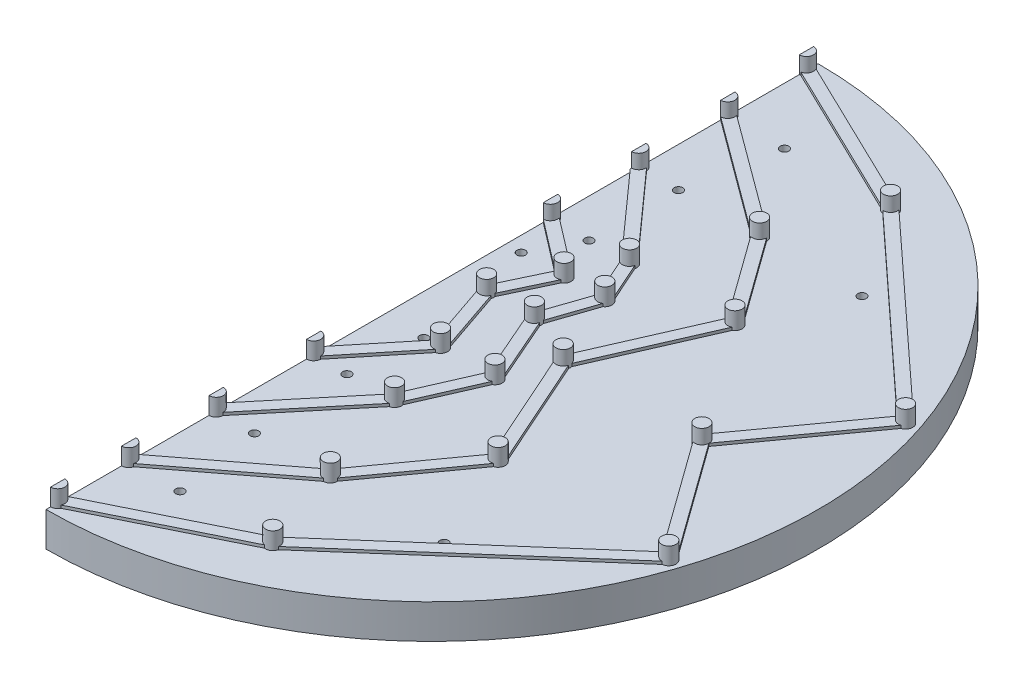
from build123d import *

# Parameters (mm, degrees)
SKETCH1_R           = 135
SKETCH1_R_2         = 7.082134324
BOSS_EXTRUDE3_DEPTH = 9
SKETCH4_R           = 135
BOSS_EXTRUDE4_DEPTH = 8
SKETCH5_R           = 2.5
SKETCH5_R_2         = 0.5
BOSS_EXTRUDE5_DEPTH = 10
BOSS_EXTRUDE7_DEPTH = 5
CUT_EXTRUDE2_START  = -9
SKETCH12_R          = 7.082134324
CUT_EXTRUDE2_DEPTH  = 9
SKETCH8_R           = 135
BOSS_EXTRUDE8_DEPTH = 4
SKETCH9_R           = 1.5
CUT_EXTRUDE1_DEPTH  = 18
CUT_EXTRUDE5_DEPTH  = 5
CUT_EXTRUDE6_DEPTH  = 20


with BuildPart() as part:
    # Sketch1 → Boss-Extrude3 (new body)
    # profile 1 of 84: a face of its own
    with BuildSketch(Plane(origin=(0, 0, 0), x_dir=(1, 0, 0), z_dir=(0, 1, 0))):
        with Locations(Location((0, 0, 0), (0, 0, 270))):
            Circle(SKETCH1_R)
        with BuildLine():
            Line((-124.38352904, -41.253827153), (-124.277916907, -41.10729095))
            ThreePointArc((-124.277916907, -41.10729095), (-130.9, 0), (-124.277916907, 41.10729095))
            Line((-124.277916907, 41.10729095), (-124.38352904, 41.253827153))
            ThreePointArc((-124.38352904, 41.253827153), (-124.403249594, 41.513922755), (-124.180715089, 41.65))
            Line((-124.180715089, 41.65), (-124.097089007, 41.65))
            ThreePointArc((-124.097089007, 41.65), (-76.554277846, 106.180283214), (-0.308426084, 130.899636643))
            Line((-0.308426084, 130.899636643), (-0.202813951, 131.046172847))
            ThreePointArc((-0.202813951, 131.046172847), (0, 131.15), (0.202813951, 131.046172847))
            Line((0.202813951, 131.046172847), (0.308426084, 130.899636643))
            ThreePointArc((0.308426084, 130.899636643), (76.554277846, 106.180283214), (124.097089007, 41.65))
            Line((124.097089007, 41.65), (124.180715089, 41.65))
            ThreePointArc((124.180715089, 41.65), (124.403249594, 41.513922755), (124.38352904, 41.253827153))
            Line((124.38352904, 41.253827153), (124.277916907, 41.10729095))
            ThreePointArc((124.277916907, 41.10729095), (129.233875828, 20.8186296), (130.9, 0))
            ThreePointArc((130.9, 0), (129.233875828, -20.8186296), (124.277916907, -41.10729095))
            Line((124.277916907, -41.10729095), (124.38352904, -41.253827153))
            ThreePointArc((124.38352904, -41.253827153), (124.403249594, -41.513922755), (124.180715089, -41.65))
            Line((124.180715089, -41.65), (124.097089007, -41.65))
            ThreePointArc((124.097089007, -41.65), (76.554277846, -106.180283214), (0.308426084, -130.899636643))
            Line((0.308426084, -130.899636643), (0.202813951, -131.046172847))
            ThreePointArc((0.202813951, -131.046172847), (0, -131.15), (-0.202813951, -131.046172847))
            Line((-0.202813951, -131.046172847), (-0.308426084, -130.899636643))
            ThreePointArc((-0.308426084, -130.899636643), (-76.554277846, -106.180283214), (-124.097089007, -41.65))
            Line((-124.097089007, -41.65), (-124.180715089, -41.65))
            ThreePointArc((-124.180715089, -41.65), (-124.403249594, -41.513922755), (-124.38352904, -41.253827153))
        make_face(mode=Mode.SUBTRACT)
    # profile 2 of 84: a face of its own
    with BuildSketch(Plane(origin=(0, 0, 0), x_dir=(1, 0, 0), z_dir=(0, 1, 0))):
        with BuildLine():
            Line((94.650912929, 0), (124.277916907, -41.10729095))
            ThreePointArc((124.277916907, -41.10729095), (129.233875828, -20.8186296), (130.9, 0))
            ThreePointArc((130.9, 0), (129.233875828, 20.8186296), (124.277916907, 41.10729095))
            Line((124.277916907, 41.10729095), (94.650912929, 0))
        make_face()
    # profile 3 of 84: a face of its own
    with BuildSketch(Plane(origin=(0, 0, 0), x_dir=(1, 0, 0), z_dir=(0, 1, 0))):
        with BuildLine():
            Line((18.039369117, -106.298059158), (0.308426084, -130.899636643))
            ThreePointArc((0.308426084, -130.899636643), (76.554277846, -106.180283214), (124.097089007, -41.65))
            Line((124.097089007, -41.65), (64.889843958, -41.65))
            Line((64.889843958, -41.65), (79.924154275, -75.397063248))
            ThreePointArc((79.924154275, -75.397063248), (79.905473966, -75.634935118), (79.695790923, -75.748799079))
            Line((79.695790923, -75.748799079), (40.278539032, -75.748799079))
            Line((40.278539032, -75.748799079), (50.600214945, -105.967250897))
            ThreePointArc((50.600214945, -105.967250897), (50.566984629, -106.193486003), (50.363635096, -106.298059158))
            Line((50.363635096, -106.298059158), (18.039369117, -106.298059158))
        make_face()
    # profile 4 of 84: a face of its own
    with BuildSketch(Plane(origin=(0, 0, 0), x_dir=(1, 0, 0), z_dir=(0, 1, 0))):
        Polygon((39.848815576, -76.037582544), (18.399731029, -105.798059158), (50.014061514, -105.798059158), align=None)
    # profile 5 of 84: a face of its own
    with BuildSketch(Plane(origin=(0, 0, 0), x_dir=(1, 0, 0), z_dir=(0, 1, 0))):
        Polygon((0.382245002, -105.798059158), (17.78340262, -105.798059158), (39.44062029, -75.748799079), (13.528033374, -75.748799079), align=None)
    # profile 6 of 84: a face of its own
    with BuildSketch(Plane(origin=(0, 0, 0), x_dir=(1, 0, 0), z_dir=(0, 1, 0))):
        Polygon((-4e-09, -75.748799079), (-12.982280674, -75.748799079), (0, -105.42430559), (12.982280674, -75.748799079), align=None)
    # profile 7 of 84: a face of its own
    with BuildSketch(Plane(origin=(0, 0, 0), x_dir=(1, 0, 0), z_dir=(0, 1, 0))):
        Polygon((-2e-09, -106.298059158), (-17.423040707, -106.298059158), (0, -130.472424008), (17.423040707, -106.298059158), align=None)
    # profile 8 of 84: a face of its own
    with BuildSketch(Plane(origin=(0, 0, 0), x_dir=(1, 0, 0), z_dir=(0, 1, 0))):
        Polygon((-39.44062029, -75.748799079), (-17.78340262, -105.798059158), (-0.382245002, -105.798059158), (-13.528033374, -75.748799079), align=None)
    # profile 9 of 84: a face of its own
    with BuildSketch(Plane(origin=(0, 0, 0), x_dir=(1, 0, 0), z_dir=(0, 1, 0))):
        Polygon((-50.014061514, -105.798059158), (-18.399731029, -105.798059158), (-39.848815576, -76.037582544), align=None)
    # profile 10 of 84: a face of its own
    with BuildSketch(Plane(origin=(0, 0, 0), x_dir=(1, 0, 0), z_dir=(0, 1, 0))):
        with BuildLine():
            Line((-64.889843958, -41.65), (-124.097089007, -41.65))
            ThreePointArc((-124.097089007, -41.65), (-76.554277846, -106.180283214), (-0.308426084, -130.899636643))
            Line((-0.308426084, -130.899636643), (-18.039369117, -106.298059158))
            Line((-18.039369117, -106.298059158), (-50.363635096, -106.298059158))
            ThreePointArc((-50.363635096, -106.298059158), (-50.566984629, -106.193486003), (-50.600214945, -105.967250897))
            Line((-50.600214945, -105.967250897), (-40.278539032, -75.748799079))
            Line((-40.278539032, -75.748799079), (-79.695790923, -75.748799079))
            ThreePointArc((-79.695790923, -75.748799079), (-79.905473966, -75.634935118), (-79.924154275, -75.397063248))
            Line((-79.924154275, -75.397063248), (-64.889843958, -41.65))
        make_face()
    # profile 11 of 84: a face of its own
    with BuildSketch(Plane(origin=(0, 0, 0), x_dir=(1, 0, 0), z_dir=(0, 1, 0))):
        with BuildLine():
            ThreePointArc((-124.277916907, 41.10729095), (-130.9, 0), (-124.277916907, -41.10729095))
            Line((-124.277916907, -41.10729095), (-94.650912929, 0))
            Line((-94.650912929, 0), (-124.277916907, 41.10729095))
        make_face()
    # profile 12 of 84: a face of its own
    with BuildSketch(Plane(origin=(0, 0, 0), x_dir=(1, 0, 0), z_dir=(0, 1, 0))):
        with BuildLine():
            ThreePointArc((-0.308426084, 130.899636643), (-76.554277846, 106.180283214), (-124.097089007, 41.65))
            Line((-124.097089007, 41.65), (-64.887027362, 41.65))
            Line((-64.887027362, 41.65), (-78.251547748, 72.199247985))
            ThreePointArc((-78.251547748, 72.199247985), (-78.231730987, 72.436287213), (-78.022506278, 72.549447812))
            Line((-78.022506278, 72.549447812), (-42.629642686, 72.549447812))
            Line((-42.629642686, 72.549447812), (-57.169541703, 103.285033746))
            ThreePointArc((-57.169541703, 103.285033746), (-57.154771859, 103.525681685), (-56.943553046, 103.641940842))
            Line((-56.943553046, 103.641940842), (-19.953696869, 103.641940842))
            Line((-19.953696869, 103.641940842), (-0.308426084, 130.899636643))
        make_face()
    # profile 13 of 84: a face of its own
    with BuildSketch(Plane(origin=(0, 0, 0), x_dir=(1, 0, 0), z_dir=(0, 1, 0))):
        Polygon((-42.189962082, 72.789255758), (-20.314058782, 103.141940842), (-56.548724494, 103.141940842), align=None)
    # profile 14 of 84: a face of its own
    with BuildSketch(Plane(origin=(0, 0, 0), x_dir=(1, 0, 0), z_dir=(0, 1, 0))):
        Polygon((-0.385061599, 103.141940842), (-19.697730373, 103.141940842), (-41.746468973, 72.549447812), (-14.014011478, 72.549447812), align=None)
    # profile 15 of 84: a face of its own
    with BuildSketch(Plane(origin=(0, 0, 0), x_dir=(1, 0, 0), z_dir=(0, 1, 0))):
        Polygon((0, 102.777604677), (-13.466638187, 72.549447812), (0, 72.549447812), (13.466638187, 72.549447812), align=None)
    # profile 16 of 84: a face of its own
    with BuildSketch(Plane(origin=(0, 0, 0), x_dir=(1, 0, 0), z_dir=(0, 1, 0))):
        Polygon((0, 130.472424008), (-19.33736846, 103.641940842), (-4e-09, 103.641940842), (19.33736846, 103.641940842), align=None)
    # profile 17 of 84: a face of its own
    with BuildSketch(Plane(origin=(0, 0, 0), x_dir=(1, 0, 0), z_dir=(0, 1, 0))):
        Polygon((41.746468973, 72.549447812), (19.697730373, 103.141940842), (0.385061599, 103.141940842), (14.014011478, 72.549447812), align=None)
    # profile 18 of 84: a face of its own
    with BuildSketch(Plane(origin=(0, 0, 0), x_dir=(1, 0, 0), z_dir=(0, 1, 0))):
        Polygon((56.548724494, 103.141940842), (20.314058782, 103.141940842), (42.189962082, 72.789255758), align=None)
    # profile 19 of 84: a face of its own
    with BuildSketch(Plane(origin=(0, 0, 0), x_dir=(1, 0, 0), z_dir=(0, 1, 0))):
        Polygon((42.723159295, 72.049447812), (64.451376596, 41.901676169), (77.640261276, 72.049447812), align=None)
    # profile 20 of 84: a face of its own
    with BuildSketch(Plane(origin=(0, 0, 0), x_dir=(1, 0, 0), z_dir=(0, 1, 0))):
        Polygon((64.99312752, 41.15), (94.342748724, 0.427575992), (123.692369928, 41.15), align=None)
    # profile 21 of 84: a face of its own
    with BuildSketch(Plane(origin=(0, 0, 0), x_dir=(1, 0, 0), z_dir=(0, 1, 0))):
        Polygon((94.342748724, -0.427575992), (64.99312752, -41.15), (123.692369928, -41.15), align=None)
    # profile 22 of 84: a face of its own
    with BuildSketch(Plane(origin=(0, 0, 0), x_dir=(1, 0, 0), z_dir=(0, 1, 0))):
        Polygon((46.501999473, -0.37535968), (64.556200791, -40.90108124), (94.034584519, 0), (64.558188122, 40.898323831), align=None)
    # profile 23 of 84: a face of its own
    with BuildSketch(Plane(origin=(0, 0, 0), x_dir=(1, 0, 0), z_dir=(0, 1, 0))):
        Polygon((34.76781542, 25.964009606), (46.226642998, 0.242724701), (64.122537357, 41.15), (28.002459562, 41.15), align=None)
    # profile 24 of 84: a face of its own
    with BuildSketch(Plane(origin=(0, 0, 0), x_dir=(1, 0, 0), z_dir=(0, 1, 0))):
        Polygon((20.661887706, 26.112273784), (34.154390465, 26.112273784), (27.610580002, 40.800967905), align=None)
    # profile 25 of 84: a face of its own
    with BuildSketch(Plane(origin=(0, 0, 0), x_dir=(1, 0, 0), z_dir=(0, 1, 0))):
        Polygon((28.012226515, 41.65), (64.016437198, 41.65), (42.279666185, 71.809639867), align=None)
    # profile 26 of 84: a face of its own
    with BuildSketch(Plane(origin=(0, 0, 0), x_dir=(1, 0, 0), z_dir=(0, 1, 0))):
        Polygon((41.839985581, 72.049447812), (14.236761384, 72.049447812), (27.624215923, 41.999032095), align=None)
    # profile 27 of 84: a face of its own
    with BuildSketch(Plane(origin=(0, 0, 0), x_dir=(1, 0, 0), z_dir=(0, 1, 0))):
        Polygon((20.276224505, 26.46626798), (27.22256941, 41.15), (13.86765052, 41.15), align=None)
    # profile 28 of 84: a face of its own
    with BuildSketch(Plane(origin=(0, 0, 0), x_dir=(1, 0, 0), z_dir=(0, 1, 0))):
        Polygon((27.232336364, 41.65), (13.689388092, 72.049447812), (0.381882927, 72.049447812), (13.649430316, 41.65), align=None)
    # profile 29 of 84: a face of its own
    with BuildSketch(Plane(origin=(0, 0, 0), x_dir=(1, 0, 0), z_dir=(0, 1, 0))):
        Polygon((0, 71.674453378), (-13.103884665, 41.65), (0, 41.65), (13.103884665, 41.65), align=None)
    # profile 30 of 84: a face of its own
    with BuildSketch(Plane(origin=(0, 0, 0), x_dir=(1, 0, 0), z_dir=(0, 1, 0))):
        Polygon((-0.349573581, 41.15), (-13.322104869, 41.15), (-19.885176226, 26.112273784), (-5.485989484, 26.112273784), align=None)
    # profile 31 of 84: a face of its own
    with BuildSketch(Plane(origin=(0, 0, 0), x_dir=(1, 0, 0), z_dir=(0, 1, 0))):
        Polygon((-27.610580002, 40.800967905), (-34.154390465, 26.112273784), (-20.661887706, 26.112273784), align=None)
    # profile 32 of 84: a face of its own
    with BuildSketch(Plane(origin=(0, 0, 0), x_dir=(1, 0, 0), z_dir=(0, 1, 0))):
        Polygon((-13.86765052, 41.15), (-27.22256941, 41.15), (-20.276224505, 26.46626798), align=None)
    # profile 33 of 84: a face of its own
    with BuildSketch(Plane(origin=(0, 0, 0), x_dir=(1, 0, 0), z_dir=(0, 1, 0))):
        Polygon((-13.689388092, 72.049447812), (-27.232336364, 41.65), (-13.649430316, 41.65), (-0.381882927, 72.049447812), align=None)
    # profile 34 of 84: a face of its own
    with BuildSketch(Plane(origin=(0, 0, 0), x_dir=(1, 0, 0), z_dir=(0, 1, 0))):
        Polygon((-14.236761384, 72.049447812), (-41.839985581, 72.049447812), (-27.624215923, 41.999032095), align=None)
    # profile 35 of 84: a face of its own
    with BuildSketch(Plane(origin=(0, 0, 0), x_dir=(1, 0, 0), z_dir=(0, 1, 0))):
        Polygon((-77.640261276, 72.049447812), (-64.451376596, 41.901676169), (-42.723159295, 72.049447812), align=None)
    # profile 36 of 84: a face of its own
    with BuildSketch(Plane(origin=(0, 0, 0), x_dir=(1, 0, 0), z_dir=(0, 1, 0))):
        Polygon((-42.279666185, 71.809639867), (-64.016437198, 41.65), (-28.012226515, 41.65), align=None)
    # profile 37 of 84: a face of its own
    with BuildSketch(Plane(origin=(0, 0, 0), x_dir=(1, 0, 0), z_dir=(0, 1, 0))):
        Polygon((-64.122537357, 41.15), (-46.226642998, 0.242724701), (-34.767815423, 25.9640096), (-28.002459562, 41.15), align=None)
    # profile 38 of 84: a face of its own
    with BuildSketch(Plane(origin=(0, 0, 0), x_dir=(1, 0, 0), z_dir=(0, 1, 0))):
        Polygon((-123.692369928, 41.15), (-94.342748724, 0.427575992), (-64.99312752, 41.15), align=None)
    # profile 39 of 84: a face of its own
    with BuildSketch(Plane(origin=(0, 0, 0), x_dir=(1, 0, 0), z_dir=(0, 1, 0))):
        Polygon((-94.342748724, -0.427575992), (-123.692369928, -41.15), (-64.99312752, -41.15), align=None)
    # profile 40 of 84: a face of its own
    with BuildSketch(Plane(origin=(0, 0, 0), x_dir=(1, 0, 0), z_dir=(0, 1, 0))):
        Polygon((-64.558188122, 40.898323831), (-94.034584519, 0), (-64.556200791, -40.90108124), (-46.501999473, -0.37535968), align=None)
    # profile 41 of 84: a face of its own
    with BuildSketch(Plane(origin=(0, 0, 0), x_dir=(1, 0, 0), z_dir=(0, 1, 0))):
        Polygon((-46.230800318, -0.995279439), (-64.11972076, -41.15), (-28.66412955, -41.15), (-39.194128118, -17.080035031), align=None)
    # profile 42 of 84: a face of its own
    with BuildSketch(Plane(origin=(0, 0, 0), x_dir=(1, 0, 0), z_dir=(0, 1, 0))):
        Polygon((79.310729324, -75.248799079), (64.453363927, -41.89891876), (40.417310612, -75.248799079), align=None)
    # profile 43 of 84: a face of its own
    with BuildSketch(Plane(origin=(0, 0, 0), x_dir=(1, 0, 0), z_dir=(0, 1, 0))):
        Polygon((-40.417310612, -75.248799079), (-64.453363927, -41.89891876), (-79.310729324, -75.248799079), align=None)
    # profile 44 of 84: a face of its own
    with BuildSketch(Plane(origin=(0, 0, 0), x_dir=(1, 0, 0), z_dir=(0, 1, 0))):
        Polygon((-28.631458129, -41.65), (-64.016437198, -41.65), (-40.009115326, -74.960015614), align=None)
    # profile 45 of 84: a face of its own
    with BuildSketch(Plane(origin=(0, 0, 0), x_dir=(1, 0, 0), z_dir=(0, 1, 0))):
        Polygon((-13.746770679, -75.248799079), (-28.253174133, -42.089381183), (-39.579391869, -75.248799079), align=None)
    # profile 46 of 84: a face of its own
    with BuildSketch(Plane(origin=(0, 0, 0), x_dir=(1, 0, 0), z_dir=(0, 1, 0))):
        Polygon((-11.798316719, -41.65), (-27.899639545, -41.65), (-13.20101798, -75.248799079), (-0.349305009, -75.248799079), align=None)
    # profile 47 of 84: a face of its own
    with BuildSketch(Plane(origin=(0, 0, 0), x_dir=(1, 0, 0), z_dir=(0, 1, 0))):
        Polygon((1e-09, -41.65), (-11.270084989, -41.65), (0, -74.72371245), (11.270084989, -41.65), align=None)
    # profile 48 of 84: a face of its own
    with BuildSketch(Plane(origin=(0, 0, 0), x_dir=(1, 0, 0), z_dir=(0, 1, 0))):
        Polygon((28.253174133, -42.089381183), (13.746770679, -75.248799079), (39.579391869, -75.248799079), align=None)
    # profile 49 of 84: a face of its own
    with BuildSketch(Plane(origin=(0, 0, 0), x_dir=(1, 0, 0), z_dir=(0, 1, 0))):
        Polygon((28.66412955, -41.15), (64.11972076, -41.15), (46.230800318, -0.995279439), (39.194128143, -17.080034973), align=None)
    # profile 50 of 84: a face of its own
    with BuildSketch(Plane(origin=(0, 0, 0), x_dir=(1, 0, 0), z_dir=(0, 1, 0))):
        Polygon((40.009115326, -74.960015614), (64.016437198, -41.65), (28.631458129, -41.65), align=None)
    # profile 51 of 84: a face of its own
    with BuildSketch(Plane(origin=(0, 0, 0), x_dir=(1, 0, 0), z_dir=(0, 1, 0))):
        Polygon((0.349305009, -75.248799079), (13.20101798, -75.248799079), (27.899639545, -41.65), (11.798316719, -41.65), align=None)
    # profile 52 of 84: a face of its own
    with BuildSketch(Plane(origin=(0, 0, 0), x_dir=(1, 0, 0), z_dir=(0, 1, 0))):
        Polygon((19.94100333, -17.754095418), (11.968695007, -41.15), (27.932310966, -41.15), align=None)
    # profile 53 of 84: a face of its own
    with BuildSketch(Plane(origin=(0, 0, 0), x_dir=(1, 0, 0), z_dir=(0, 1, 0))):
        Polygon((20.290295308, -17.229835196), (28.310594963, -40.710618817), (38.582841649, -17.229835196), align=None)
    # profile 54 of 84: a face of its own
    with BuildSketch(Plane(origin=(0, 0, 0), x_dir=(1, 0, 0), z_dir=(0, 1, 0))):
        Polygon((38.965357754, -16.355461929), (45.955443842, -0.377195058), (34.57048907, 25.178269787), (28.549732773, 7.509480006), align=None)
    # profile 55 of 84: a face of its own
    with BuildSketch(Plane(origin=(0, 0, 0), x_dir=(1, 0, 0), z_dir=(0, 1, 0))):
        Polygon((20.64894208, 25.612273784), (28.253100546, 8.189142616), (34.190147055, 25.612273784), align=None)
    # profile 56 of 84: a face of its own
    with BuildSketch(Plane(origin=(0, 0, 0), x_dir=(1, 0, 0), z_dir=(0, 1, 0))):
        Polygon((19.885176226, 26.112273784), (13.322104869, 41.15), (0.349573581, 41.15), (5.485989484, 26.112273784), align=None)
    # profile 57 of 84: a face of its own
    with BuildSketch(Plane(origin=(0, 0, 0), x_dir=(1, 0, 0), z_dir=(0, 1, 0))):
        Polygon((0, 40.626564221), (-4.957626648, 26.112273784), (4.957626648, 26.112273784), align=None)
    # profile 58 of 84: a face of its own
    with BuildSketch(Plane(origin=(0, 0, 0), x_dir=(1, 0, 0), z_dir=(0, 1, 0))):
        Polygon((-34.190147055, 25.612273784), (-28.253100546, 8.189142616), (-20.64894208, 25.612273784), align=None)
    # profile 59 of 84: a face of its own
    with BuildSketch(Plane(origin=(0, 0, 0), x_dir=(1, 0, 0), z_dir=(0, 1, 0))):
        Polygon((-34.57048907, 25.178269787), (-45.955443842, -0.377195058), (-38.965357754, -16.355461929), (-28.549732773, 7.509480006), align=None)
    # profile 60 of 84: a face of its own
    with BuildSketch(Plane(origin=(0, 0, 0), x_dir=(1, 0, 0), z_dir=(0, 1, 0))):
        Polygon((-38.582841649, -17.229835196), (-28.310594963, -40.710618817), (-20.290295308, -17.229835196), align=None)
    # profile 61 of 84: a face of its own
    with BuildSketch(Plane(origin=(0, 0, 0), x_dir=(1, 0, 0), z_dir=(0, 1, 0))):
        Polygon((-19.94100333, -17.754095418), (-27.932310966, -41.15), (-11.968695007, -41.15), align=None)
    # profile 62 of 84: a face of its own
    with BuildSketch(Plane(origin=(0, 0, 0), x_dir=(1, 0, 0), z_dir=(0, 1, 0))):
        Polygon((-19.591416717, -17.229835196), (-11.440463277, -41.15), (-0.433398927, -41.15), (-14.268343199, -17.229835196), align=None)
    # profile 63 of 84: a face of its own
    with BuildSketch(Plane(origin=(0, 0, 0), x_dir=(1, 0, 0), z_dir=(0, 1, 0))):
        Polygon((3e-09, -17.229835196), (-13.690735332, -17.229835196), (0, -40.900667473), (13.690735332, -17.229835196), align=None)
    # profile 64 of 84: a face of its own
    with BuildSketch(Plane(origin=(0, 0, 0), x_dir=(1, 0, 0), z_dir=(0, 1, 0))):
        Polygon((0.433398927, -41.15), (11.440463277, -41.15), (19.591416717, -17.229835196), (14.268343199, -17.229835196), align=None)
    # profile 65 of 84: a face of its own
    with BuildSketch(Plane(origin=(0, 0, 0), x_dir=(1, 0, 0), z_dir=(0, 1, 0))):
        Polygon((38.583203725, -16.729835196), (28.310542102, 6.807540005), (20.290026735, -16.729835196), align=None)
    # profile 66 of 84: a face of its own
    with BuildSketch(Plane(origin=(0, 0, 0), x_dir=(1, 0, 0), z_dir=(0, 1, 0))):
        Polygon((27.899938397, 7.74834131), (20.257893801, 25.258279588), (11.974572478, 7.74834131), align=None)
    # profile 67 of 84: a face of its own
    with BuildSketch(Plane(origin=(0, 0, 0), x_dir=(1, 0, 0), z_dir=(0, 1, 0))):
        Polygon((19.872230601, 25.612273784), (5.656773811, 25.612273784), (11.61719592, 8.162130043), align=None)
    # profile 68 of 84: a face of its own
    with BuildSketch(Plane(origin=(0, 0, 0), x_dir=(1, 0, 0), z_dir=(0, 1, 0))):
        Polygon((-5.656773811, 25.612273784), (-19.872230601, 25.612273784), (-11.61719592, 8.162130043), align=None)
    # profile 69 of 84: a face of its own
    with BuildSketch(Plane(origin=(0, 0, 0), x_dir=(1, 0, 0), z_dir=(0, 1, 0))):
        Polygon((5.128410975, 25.612273784), (-5.128410975, 25.612273784), (-11.230170344, 7.74834131), (2.5e-08, 7.74834131), (11.230170344, 7.74834131), align=None)
    # profile 70 of 84: a face of its own
    with BuildSketch(Plane(origin=(0, 0, 0), x_dir=(1, 0, 0), z_dir=(0, 1, 0))):
        Polygon((-20.290026735, -16.729835196), (-28.310542102, 6.807540005), (-38.583203725, -16.729835196), align=None)
    # profile 71 of 84: a face of its own
    with BuildSketch(Plane(origin=(0, 0, 0), x_dir=(1, 0, 0), z_dir=(0, 1, 0))):
        Polygon((-11.974572478, 7.74834131), (-20.257893801, 25.258279588), (-27.899938397, 7.74834131), align=None)
    # profile 72 of 84: a face of its own
    with BuildSketch(Plane(origin=(0, 0, 0), x_dir=(1, 0, 0), z_dir=(0, 1, 0))):
        Polygon((-27.22480771, 5.171466918), (-19.940440123, -16.205574975), (-18.054398633, -10.683869549), align=None)
    # profile 73 of 84: a face of its own
    with BuildSketch(Plane(origin=(0, 0, 0), x_dir=(1, 0, 0), z_dir=(0, 1, 0))):
        Polygon((-11.929317507, 7.24834131), (-27.848422397, 7.24834131), (-17.839938025, -10.05599985), align=None)
    # profile 74 of 84: a face of its own
    with BuildSketch(Plane(origin=(0, 0, 0), x_dir=(1, 0, 0), z_dir=(0, 1, 0))):
        Polygon((11.929317507, 7.24834131), (17.839938025, -10.05599985), (27.848422397, 7.24834131), align=None)
    # profile 75 of 84: a face of its own
    with BuildSketch(Plane(origin=(0, 0, 0), x_dir=(1, 0, 0), z_dir=(0, 1, 0))):
        Polygon((18.054398633, -10.683869549), (19.940440123, -16.205574975), (27.22480771, 5.171466918), align=None)
    # profile 76 of 84: a face of its own
    with BuildSketch(Plane(origin=(0, 0, 0), x_dir=(1, 0, 0), z_dir=(0, 1, 0))):
        Polygon((17.722212167, -11.25820905), (14.557533185, -16.729835196), (19.591148145, -16.729835196), align=None)
    # profile 77 of 84: a face of its own
    with BuildSketch(Plane(origin=(0, 0, 0), x_dir=(1, 0, 0), z_dir=(0, 1, 0))):
        Polygon((-17.722212167, -11.25820905), (-19.591148145, -16.729835196), (-14.557533185, -16.729835196), align=None)
    # profile 78 of 84: a face of its own
    with BuildSketch(Plane(origin=(0, 0, 0), x_dir=(1, 0, 0), z_dir=(0, 1, 0))):
        Polygon((-17.50775156, -10.630339352), (-13.979925318, -16.729835196), (-0.394828552, -16.729835196), (-6.853905402, -3.076128844), (-11.542291931, 6.834552578), align=None)
    # profile 79 of 84: a face of its own
    with BuildSketch(Plane(origin=(0, 0, 0), x_dir=(1, 0, 0), z_dir=(0, 1, 0))):
        Polygon((0.394828552, -16.729835196), (13.979925318, -16.729835196), (17.50775156, -10.630339352), (11.542291931, 6.834552578), (6.853905369, -3.076128913), align=None)
    # profile 80 of 84: a face of its own
    with BuildSketch(Plane(origin=(0, 0, 0), x_dir=(1, 0, 0), z_dir=(0, 1, 0))):
        with BuildLine():
            Line((-5.243999611, -5.310035244), (0, -16.395215445))
            Line((0, -16.395215445), (5.243999611, -5.310035244))
            ThreePointArc((5.243999611, -5.310035244), (0, -7.415927337), (-5.243999611, -5.310035244))
        make_face()
    # profile 81 of 84: a face of its own
    with BuildSketch(Plane(origin=(0, 0, 0), x_dir=(1, 0, 0), z_dir=(0, 1, 0))):
        with BuildLine():
            Line((-11.184915373, 7.24834131), (-7.559856546, -0.414594104))
            ThreePointArc((-7.559856546, -0.414594104), (-6.405957651, 4.222371119), (-2.707791411, 7.24834131))
            Line((-2.707791411, 7.24834131), (-11.184915373, 7.24834131))
        make_face()
    # profile 82 of 84: a face of its own
    with BuildSketch(Plane(origin=(0, 0, 0), x_dir=(1, 0, 0), z_dir=(0, 1, 0))):
        with BuildLine():
            ThreePointArc((7.582134324, 0.166206987), (7.576562832, -0.124407107), (7.559856546, -0.414594104))
            Line((7.559856546, -0.414594104), (11.184915373, 7.24834131))
            Line((11.184915373, 7.24834131), (2.707791411, 7.24834131))
            ThreePointArc((2.707791411, 7.24834131), (6.245782541, 4.464923232), (7.582134324, 0.166206987))
        make_face()
    # profile 83 of 84: a face of its own
    with BuildSketch(Plane(origin=(0, 0, 0), x_dir=(1, 0, 0), z_dir=(0, 1, 0))):
        with Locations(Location((0, 0.166206987, 0), (0, 0, 270))):
            Circle(SKETCH1_R_2)
    # profile 84 of 84: a face of its own
    with BuildSketch(Plane(origin=(0, 0, 0), x_dir=(1, 0, 0), z_dir=(0, 1, 0))):
        with BuildLine():
            ThreePointArc((124.097089007, 41.65), (76.554277846, 106.180283214), (0.308426084, 130.899636643))
            Line((0.308426084, 130.899636643), (19.953696869, 103.641940842))
            Line((19.953696869, 103.641940842), (56.943553046, 103.641940842))
            ThreePointArc((56.943553046, 103.641940842), (57.154771859, 103.525681685), (57.169541703, 103.285033746))
            Line((57.169541703, 103.285033746), (42.629642686, 72.549447812))
            Line((42.629642686, 72.549447812), (78.022506278, 72.549447812))
            ThreePointArc((78.022506278, 72.549447812), (78.231730987, 72.436287213), (78.251547748, 72.199247985))
            Line((78.251547748, 72.199247985), (64.887027362, 41.65))
            Line((64.887027362, 41.65), (124.097089007, 41.65))
        make_face()
    extrude(amount=BOSS_EXTRUDE3_DEPTH)

    # Sketch4 → Boss-Extrude4 (add)
    with BuildSketch(Plane.XZ):
        with Locations(Location((0, 0, 0), (0, 0, 270))):
            Circle(SKETCH4_R)
    extrude(amount=-BOSS_EXTRUDE4_DEPTH)

    # Sketch5 → Boss-Extrude5 (add)
    with BuildSketch(Plane(origin=(0, 8, 0), x_dir=(1, 0, 0), z_dir=(0, 1, 0))):
        with Locations(Location((-64.504782359, 41.4, 0), (0, 0, 107.888986274))):
            Circle(SKETCH5_R)
        with Locations(Location((-64.504782359, -41.4, 0), (0, 0, 71.726207321))):
            Circle(SKETCH5_R)
        with Locations(Location((64.504782359, -41.4, 0), (0, 0, 108.273792679))):
            Circle(SKETCH5_R)
        with Locations(Location((64.504782359, 41.4, 0), (0, 0, 72.111013726))):
            Circle(SKETCH5_R)
        with Locations(Location((-124.180715089, 41.4, 0), (0, 0, 5.739170477))):
            Circle(SKETCH5_R)
        with Locations(Location((-124.180715089, -41.4, 0), (0, 0, 59.957979549))):
            Circle(SKETCH5_R)
        with Locations(Location((124.180715089, -41.4, 0), (0, 0, 120.042020451))):
            Circle(SKETCH5_R)
        with Locations(Location((124.180715089, 41.4, 0), (0, 0, 174.260829523))):
            Circle(SKETCH5_R)
        with Locations(Location((0, -130.9, 0), (0, 0, 59.957979549))):
            Circle(SKETCH5_R)
        with Locations(Location((0, 130.9, 0), (0, 0, 228.479638594))):
            Circle(SKETCH5_R)
        with Locations(Location((-50.363635096, -106.048059158, 0), (0, 0, 76.880611758))):
            Circle(SKETCH5_R)
        with Locations(Location((50.363635096, -106.048059158, 0), (0, 0, 103.119388242))):
            Circle(SKETCH5_R)
        with Locations(Location((0, -106.048059158, 0), (0, 0, 107.888986274))):
            Circle(SKETCH5_R)
        with Locations(Location((0, 103.391940842, 0), (0, 0, 5.739170477))):
            Circle(SKETCH5_R)
        with Locations(Location((94.342748724, 0, 0), (0, 0, 59.957979549))):
            Circle(SKETCH5_R)
        with Locations(Location((56.943553046, 103.391940842, 0), (0, 0, 174.260829523))):
            Circle(SKETCH5_R)
        with Locations(Location((-56.943553046, 103.391940842, 0), (0, 0, 5.739170477))):
            Circle(SKETCH5_R)
        with Locations(Location((-42.234814134, 72.299447812, 0), (0, 0, 109.577974891))):
            Circle(SKETCH5_R)
        with Locations(Location((-39.928965451, -75.498799079, 0), (0, 0, 76.880611758))):
            Circle(SKETCH5_R)
        with Locations(Location((39.928965451, -75.498799079, 0), (0, 0, 103.119388242))):
            Circle(SKETCH5_R)
        with Locations(Location((46.228721658, -0.376277369, 0), (0, 0, 72.111013726))):
            Circle(SKETCH5_R)
        with Locations(Location((42.234814134, 72.299447812, 0), (0, 0, 70.422025109))):
            Circle(SKETCH5_R)
        with Locations(Location((0, 72.299447812, 0), (0, 0, 5.739170477))):
            Circle(SKETCH5_R)
        with Locations(Location((-27.617397963, 41.4, 0), (0, 0, 71.726207321))):
            Circle(SKETCH5_R)
        with Locations(Location((-34.539452064, 25.862273784, 0), (0, 0, 71.726207321))):
            Circle(SKETCH5_R)
        with Locations(Location((-28.281821324, 7.49834131, 0), (0, 0, 103.077710518))):
            Circle(SKETCH5_R)
        with Locations(Location((-38.965086652, -16.979835196, 0), (0, 0, 72.160769311))):
            Circle(SKETCH5_R)
        with Locations(Location((-28.281884548, -41.4, 0), (0, 0, 76.880611758))):
            Circle(SKETCH5_R)
        with Locations(Location((0, -75.498799079, 0), (0, 0, 76.922289482))):
            Circle(SKETCH5_R)
        with Locations(Location((28.281884548, -41.4, 0), (0, 0, 103.119388242))):
            Circle(SKETCH5_R)
        with Locations(Location((38.965086652, -16.979835196, 0), (0, 0, 107.839230689))):
            Circle(SKETCH5_R)
        with Locations(Location((28.281821324, 7.49834131, 0), (0, 0, 76.922289482))):
            Circle(SKETCH5_R)
        with Locations(Location((34.539452064, 25.862273784, 0), (0, 0, 108.273792679))):
            Circle(SKETCH5_R)
        with Locations(Location((27.617397963, 41.4, 0), (0, 0, 108.273792679))):
            Circle(SKETCH5_R)
        with Locations(Location((-94.342748724, 0, 0), (0, 0, 59.957979549))):
            Circle(SKETCH5_R)
        with Locations(Location((-46.228721658, -0.376277369, 0), (0, 0, 107.888986274))):
            Circle(SKETCH5_R)
        with Locations(Location((0, -41.4, 0), (0, 0, 65.694941947))):
            Circle(SKETCH5_R)
        with Locations(Location((19.940721726, -16.979835196, 0), (0, 0, 76.922289482))):
            Circle(SKETCH5_R)
        with Locations(Location((11.579743926, 7.49834131, 0), (0, 0, 103.119388242))):
            Circle(SKETCH5_R)
        with Locations(Location((20.267059153, 25.862273784, 0), (0, 0, 107.839230689))):
            Circle(SKETCH5_R)
        with Locations(Location((0, 41.4, 0), (0, 0, 5.739170477))):
            Circle(SKETCH5_R)
        with Locations(Location((-20.267059153, 25.862273784, 0), (0, 0, 72.160769311))):
            Circle(SKETCH5_R)
        with Locations(Location((-11.579743926, 7.49834131, 0), (0, 0, 76.880611758))):
            Circle(SKETCH5_R)
        with Locations(Location((-19.940721726, -16.979835196, 0), (0, 0, 103.077710518))):
            Circle(SKETCH5_R)
        with Locations(Location((-79.695790923, -75.498799079, 0), (0, 0, 95.987036844))):
            Circle(SKETCH5_R_2)
        with Locations(Location((-78.022506278, 72.299447812, 0), (0, 0, 30))):
            Circle(SKETCH5_R_2)
        with Locations(Location((78.022506278, 72.299447812, 0), (0, 0, 150))):
            Circle(SKETCH5_R_2)
        with Locations(Location((79.695790923, -75.498799079, 0), (0, 0, 84.012963156))):
            Circle(SKETCH5_R_2)
        with Locations(Location((-17.911385868, -106.048059158, 0), (0, 0, 95.781190929))):
            Circle(SKETCH5_R_2)
        with Locations(Location((17.911385868, -106.048059158, 0), (0, 0, 84.218809071))):
            Circle(SKETCH5_R_2)
        with Locations(Location((19.825713621, 103.391940842, 0), (0, 0, 95.781190929))):
            Circle(SKETCH5_R_2)
        with Locations(Location((-19.825713621, 103.391940842, 0), (0, 0, 84.218809071))):
            Circle(SKETCH5_R_2)
        with Locations(Location((13.851699785, 72.299447812, 0), (0, 0, 84.012963156))):
            Circle(SKETCH5_R_2)
        with Locations(Location((-13.851699785, 72.299447812, 0), (0, 0, 95.987036844))):
            Circle(SKETCH5_R_2)
        with Locations(Location((13.485767593, 41.4, 0), (0, 0, 83.578401166))):
            Circle(SKETCH5_R_2)
        with Locations(Location((-13.485767593, 41.4, 0), (0, 0, 96.421598834))):
            Circle(SKETCH5_R_2)
        with Locations(Location((5.307200229, 25.862273784, 0), (0, 0, 78.85855872))):
            Circle(SKETCH5_R_2)
        with Locations(Location((-5.307200229, 25.862273784, 0), (0, 0, 101.14144128))):
            Circle(SKETCH5_R_2)
        with Locations(Location((14.124134258, -16.979835196, 0), (0, 0, 89.95577147))):
            Circle(SKETCH5_R_2)
        with Locations(Location((-14.124134258, -16.979835196, 0), (0, 0, 90.04422853))):
            Circle(SKETCH5_R_2)
        with Locations(Location((11.619389998, -41.4, 0), (0, 0, 101.183119005))):
            Circle(SKETCH5_R_2)
        with Locations(Location((-11.619389998, -41.4, 0), (0, 0, 78.816880995))):
            Circle(SKETCH5_R_2)
        with Locations(Location((-13.364525677, -75.498799079, 0), (0, 0, 83.628156752))):
            Circle(SKETCH5_R_2)
        with Locations(Location((13.364525677, -75.498799079, 0), (0, 0, 96.371843248))):
            Circle(SKETCH5_R_2)
    extrude(amount=BOSS_EXTRUDE5_DEPTH)

    # Boss-Extrude7: read off the stored shape, not the designer's step
    # Boss-Extrude7 outline → Boss-Extrude7 (add)
    with BuildSketch(Plane(origin=(0, 8, 0), x_dir=(1, 0, 0), z_dir=(0, 1, 0))):
        with BuildLine():
            Line((-1.251587511, 128.735853817), (-1.983110413, 127.720870163))
            Line((-1.983110413, 127.720870163), (-0.480698107, 128.446649367))
            ThreePointArc((-0.480698107, 128.446649367), (-0.878130497, 128.559297791), (-1.251587511, 128.735853817))
        make_face()
        with BuildLine():
            Line((-2.928637685, 127.264108708), (-1.657215414, 129.02819951))
            ThreePointArc((-1.657215414, 129.02819951), (-2.457604414, 130.441545481), (-2.220621138, 132.04840836))
            Line((-2.220621138, 132.04840836), (-56.46285494, 105.845291476))
            ThreePointArc((-56.46285494, 105.845291476), (-54.692453676, 104.479392737), (-54.722931908, 102.243532483))
            Line((-54.722931908, 102.243532483), (-2.928637685, 127.264108708))
        make_face()
        with BuildLine():
            ThreePointArc((2.220621138, 132.04840836), (2.251099371, 129.812548106), (0.480698107, 128.446649367))
            Line((0.480698107, 128.446649367), (54.722931908, 102.243532483))
            ThreePointArc((54.722931908, 102.243532483), (54.692453676, 104.479392737), (56.46285494, 105.845291476))
            Line((56.46285494, 105.845291476), (2.220621138, 132.04840836))
        make_face()
        with BuildLine():
            Line((56.690659405, 100.904764771), (121.521700716, 41.131241387))
            Line((121.521700716, 41.131241387), (93.597274194, 2.386266482))
            ThreePointArc((93.597274194, 2.386266482), (95.804477192, 2.028139513), (96.842297416, 0.047500933))
            Line((96.842297416, 0.047500933), (124.926189619, 39.013733518))
            ThreePointArc((124.926189619, 39.013733518), (121.693388144, 41.148594612), (124.43360873, 43.887176071))
            Line((124.43360873, 43.887176071), (59.402052293, 103.845572246))
            ThreePointArc((59.402052293, 103.845572246), (58.781557718, 101.697320287), (56.690659405, 100.904764771))
        make_face()
        with BuildLine():
            Line((-121.521700716, 41.131241387), (-56.690659405, 100.904764771))
            ThreePointArc((-56.690659405, 100.904764771), (-58.781557718, 101.697320287), (-59.402052293, 103.845572246))
            Line((-59.402052293, 103.845572246), (-124.43360873, 43.887176071))
            ThreePointArc((-124.43360873, 43.887176071), (-121.693388144, 41.148594612), (-124.926189619, 39.013733518))
            Line((-124.926189619, 39.013733518), (-96.842297416, 0.047500933))
            ThreePointArc((-96.842297416, 0.047500933), (-95.804477192, 2.028139513), (-93.597274194, 2.386266482))
            Line((-93.597274194, 2.386266482), (-121.521700716, 41.131241387))
        make_face()
        with BuildLine():
            Line((93.597274194, -2.386266482), (121.494711581, -41.093794124))
            Line((121.494711581, -41.093794124), (50.174379813, -103.555232963))
            ThreePointArc((50.174379813, -103.555232963), (52.244342882, -104.400959215), (52.809739722, -106.564365421))
            Line((52.809739722, -106.564365421), (124.369970371, -43.892826195))
            ThreePointArc((124.369970371, -43.892826195), (121.696803598, -41.116832724), (124.926189619, -39.013733518))
            Line((124.926189619, -39.013733518), (96.842297416, -0.047500933))
            ThreePointArc((96.842297416, -0.047500933), (95.804477192, -2.028139513), (93.597274194, -2.386266482))
        make_face()
        with BuildLine():
            Line((-121.494711581, -41.093794124), (-93.597274194, -2.386266482))
            ThreePointArc((-93.597274194, -2.386266482), (-95.804477192, -2.028139513), (-96.842297416, -0.047500933))
            Line((-96.842297416, -0.047500933), (-124.926189619, -39.013733518))
            ThreePointArc((-124.926189619, -39.013733518), (-121.696803598, -41.116832724), (-124.369970371, -43.892826195))
            Line((-124.369970371, -43.892826195), (-52.809739722, -106.564365421))
            ThreePointArc((-52.809739722, -106.564365421), (-52.244342882, -104.400959215), (-50.174379813, -103.555232963))
            Line((-50.174379813, -103.555232963), (-121.494711581, -41.093794124))
        make_face()
        with BuildLine():
            ThreePointArc((49.903505498, -108.505350503), (48.121724261, -107.154330286), (48.133471693, -104.918293167))
            Line((48.133471693, -104.918293167), (0.460129598, -128.442708655))
            ThreePointArc((0.460129598, -128.442708655), (2.241910835, -129.793728872), (2.230163403, -132.029765991))
            Line((2.230163403, -132.029765991), (49.903505498, -108.505350503))
        make_face()
        with BuildLine():
            Line((-0.460129598, -128.442708655), (-48.133471693, -104.918293167))
            ThreePointArc((-48.133471693, -104.918293167), (-48.121724261, -107.154330286), (-49.903505498, -108.505350503))
            Line((-49.903505498, -108.505350503), (-2.230163403, -132.029765991))
            ThreePointArc((-2.230163403, -132.029765991), (-2.241910835, -129.793728872), (-0.460129598, -128.442708655))
        make_face()
        with BuildLine():
            Line((-62.005233667, 41.447500933), (-41.489339604, 69.91318133))
            ThreePointArc((-41.489339604, 69.91318133), (-43.696542602, 70.271308299), (-44.734362826, 72.251946879))
            Line((-44.734362826, 72.251946879), (-65.250256889, 43.786266482))
            ThreePointArc((-65.250256889, 43.786266482), (-63.043053891, 43.428139513), (-62.005233667, 41.447500933))
        make_face()
        with BuildLine():
            Line((-39.841140973, 71.578109613), (-0.022256186, 100.892039912))
            ThreePointArc((-0.022256186, 100.892039912), (-2.013274456, 101.909805233), (-2.393673161, 104.113279041))
            Line((-2.393673161, 104.113279041), (-42.212557948, 74.799348742))
            ThreePointArc((-42.212557948, 74.799348742), (-40.221539678, 73.781583422), (-39.841140973, 71.578109613))
        make_face()
        with BuildLine():
            Line((-44.997588871, 1.799570066), (-62.071251641, 40.827349807))
            ThreePointArc((-62.071251641, 40.827349807), (-63.502784083, 39.109585309), (-65.735915146, 39.224152565))
            Line((-65.735915146, 39.224152565), (-48.662252376, 0.196372824))
            ThreePointArc((-48.662252376, 0.196372824), (-47.230719934, 1.914137322), (-44.997588871, 1.799570066))
        make_face()
        with BuildLine():
            Line((0.022256186, 100.892039912), (39.841140973, 71.578109613))
            ThreePointArc((39.841140973, 71.578109613), (40.221539678, 73.781583422), (42.212557948, 74.799348742))
            Line((42.212557948, 74.799348742), (2.393673161, 104.113279041))
            ThreePointArc((2.393673161, 104.113279041), (2.013274456, 101.909805233), (0.022256186, 100.892039912))
        make_face()
        with BuildLine():
            Line((-62.067460555, -40.843706529), (-45.012229821, -2.560344128))
            ThreePointArc((-45.012229821, -2.560344128), (-47.246079963, -2.659910895), (-48.666043462, -0.93257084))
            Line((-48.666043462, -0.93257084), (-65.721274196, -39.215933241))
            ThreePointArc((-65.721274196, -39.215933241), (-63.487424054, -39.116366475), (-62.067460555, -40.843706529))
        make_face()
        with BuildLine():
            Line((41.489339604, 69.91318133), (62.005233667, 41.447500933))
            ThreePointArc((62.005233667, 41.447500933), (63.043053891, 43.428139513), (65.250256889, 43.786266482))
            Line((65.250256889, 43.786266482), (44.734362826, 72.251946879))
            ThreePointArc((44.734362826, 72.251946879), (43.696542602, 70.271308299), (41.489339604, 69.91318133))
        make_face()
        with BuildLine():
            Line((62.071251641, 40.827349807), (44.997588871, 1.799570066))
            ThreePointArc((44.997588871, 1.799570066), (47.230719934, 1.914137322), (48.662252376, 0.196372824))
            Line((48.662252376, 0.196372824), (65.735915146, 39.224152565))
            ThreePointArc((65.735915146, 39.224152565), (63.502784083, 39.109585309), (62.071251641, 40.827349807))
        make_face()
        with BuildLine():
            Line((-39.183490921, -73.112532597), (-62.005233667, -41.447500933))
            ThreePointArc((-62.005233667, -41.447500933), (-63.043053891, -43.428139513), (-65.250256889, -43.786266482))
            Line((-65.250256889, -43.786266482), (-42.428514143, -75.451298145))
            ThreePointArc((-42.428514143, -75.451298145), (-41.390693919, -73.470659566), (-39.183490921, -73.112532597))
        make_face()
        with BuildLine():
            Line((45.012229821, -2.560344128), (62.067460555, -40.843706529))
            ThreePointArc((62.067460555, -40.843706529), (63.487424054, -39.116366475), (65.721274196, -39.215933241))
            Line((65.721274196, -39.215933241), (48.666043462, -0.93257084))
            ThreePointArc((48.666043462, -0.93257084), (47.246079963, -2.659910895), (45.012229821, -2.560344128))
        make_face()
        with BuildLine():
            Line((0, -103.529835172), (-37.522364281, -74.821842058))
            ThreePointArc((-37.522364281, -74.821842058), (-37.943439132, -77.017905803), (-39.952935039, -77.998684168))
            Line((-39.952935039, -77.998684168), (-2.40660117, -106.725016178))
            ThreePointArc((-2.40660117, -106.725016178), (0, -103.548059158), (2.40660117, -106.725016178))
            Line((2.40660117, -106.725016178), (39.952935039, -77.998684168))
            ThreePointArc((39.952935039, -77.998684168), (37.943439132, -77.017905803), (37.522364281, -74.821842058))
            Line((37.522364281, -74.821842058), (0, -103.529835172))
        make_face()
        with BuildLine():
            Line((62.005233667, -41.447500933), (39.183490921, -73.112532597))
            ThreePointArc((39.183490921, -73.112532597), (41.390693919, -73.470659566), (42.428514143, -75.451298145))
            Line((42.428514143, -75.451298145), (65.250256889, -43.786266482))
            ThreePointArc((65.250256889, -43.786266482), (63.043053891, -43.428139513), (62.005233667, -41.447500933))
        make_face()
        with BuildLine():
            Line((-20.541127981, -19.406666943), (-2.497872229, -41.503122885))
            ThreePointArc((-2.497872229, -41.503122885), (0, -38.9), (2.497872229, -41.503122885))
            Line((2.497872229, -41.503122885), (20.541127981, -19.406666943))
            ThreePointArc((20.541127981, -19.406666943), (18.359500081, -18.916259248), (17.442849497, -16.876712311))
            Line((17.442849497, -16.876712311), (0, -38.237887961))
            Line((0, -38.237887961), (-17.442849497, -16.876712311))
            ThreePointArc((-17.442849497, -16.876712311), (-18.359500081, -18.916259248), (-20.541127981, -19.406666943))
        make_face()
        with BuildLine():
            ThreePointArc((-21.348510956, -14.913890017), (-19.13263912, -14.614036705), (-17.563233369, -16.206822187))
            Line((-17.563233369, -16.206822187), (-10.171954696, 5.432396131))
            ThreePointArc((-10.171954696, 5.432396131), (-12.387826532, 5.132542819), (-13.957232283, 6.725328301))
            Line((-13.957232283, 6.725328301), (-21.348510956, -14.913890017))
        make_face()
        with BuildLine():
            Line((-36.53205414, -16.405071944), (-27.162327638, 5.063440923))
            Line((-27.162327638, 5.063440923), (-27.048799499, 5.323563809))
            ThreePointArc((-27.048799499, 5.323563809), (-29.281830229, 5.207057349), (-30.714853836, 6.923578058))
            Line((-30.714853836, 6.923578058), (-40.198108477, -14.805057695))
            ThreePointArc((-40.198108477, -14.805057695), (-37.965077747, -14.688551235), (-36.53205414, -16.405071944))
        make_face()
        with BuildLine():
            Line((-21.433525827, 23.651085077), (-14.029095754, 7.999016479))
            ThreePointArc((-14.029095754, 7.999016479), (-12.648814887, 9.758227873), (-10.413277252, 9.709530017))
            Line((-10.413277252, 9.709530017), (-17.768531985, 25.2576479))
            Line((-17.768531985, 25.2576479), (0, 38.879880073))
            Line((0, 38.879880073), (17.768531985, 25.2576479))
            Line((17.768531985, 25.2576479), (10.413277252, 9.709530017))
            ThreePointArc((10.413277252, 9.709530017), (12.648814887, 9.758227873), (14.029095754, 7.999016479))
            Line((14.029095754, 7.999016479), (21.433525827, 23.651085077))
            ThreePointArc((21.433525827, 23.651085077), (17.837194119, 25.27426365), (20.293485317, 28.362134112))
            Line((20.293485317, 28.362134112), (2.40726524, 42.074591775))
            ThreePointArc((2.40726524, 42.074591775), (0, 38.9), (-2.40726524, 42.074591775))
            Line((-2.40726524, 42.074591775), (-20.293485317, 28.362134112))
            ThreePointArc((-20.293485317, 28.362134112), (-17.837194119, 25.27426365), (-21.433525827, 23.651085077))
        make_face()
        with BuildLine():
            Line((-26.872529671, 9.563261899), (-32.162526636, 25.087531562))
            ThreePointArc((-32.162526636, 25.087531562), (-33.733090585, 23.495888108), (-35.948743717, 23.797353196))
            Line((-35.948743717, 23.797353196), (-30.658746752, 8.273083533))
            ThreePointArc((-30.658746752, 8.273083533), (-29.088182803, 9.864726986), (-26.872529671, 9.563261899))
        make_face()
        with BuildLine():
            Line((-27.050751761, -39.224152565), (-36.531555934, -17.55248539))
            ThreePointArc((-36.531555934, -17.55248539), (-37.963088376, -19.270249887), (-40.196219439, -19.155682631))
            Line((-40.196219439, -19.155682631), (-30.715415266, -40.827349807))
            ThreePointArc((-30.715415266, -40.827349807), (-29.283882824, -39.109585309), (-27.050751761, -39.224152565))
        make_face()
        with BuildLine():
            ThreePointArc((-25.784875077, -41.27775557), (-26.685883321, -43.324260919), (-28.863692547, -43.831357533))
            Line((-28.863692547, -43.831357533), (-2.497009471, -75.621043509))
            ThreePointArc((-2.497009471, -75.621043509), (0, -72.998799079), (2.497009471, -75.621043509))
            Line((2.497009471, -75.621043509), (28.863692547, -43.831357533))
            ThreePointArc((28.863692547, -43.831357533), (26.685883321, -43.324260919), (25.784875077, -41.27775557))
            Line((25.784875077, -41.27775557), (0, -72.365969406))
            Line((0, -72.365969406), (-25.784875077, -41.27775557))
        make_face()
        with BuildLine():
            Line((21.348510956, -14.913890017), (13.957232283, 6.725328301))
            ThreePointArc((13.957232283, 6.725328301), (12.387826532, 5.132542819), (10.171954696, 5.432396131))
            Line((10.171954696, 5.432396131), (17.563233369, -16.206822187))
            ThreePointArc((17.563233369, -16.206822187), (19.13263912, -14.614036705), (21.348510956, -14.913890017))
        make_face()
        with BuildLine():
            Line((-32.10213026, 26.418567255), (-26.400906126, 39.215933241))
            ThreePointArc((-26.400906126, 39.215933241), (-28.634756268, 39.116366474), (-30.054719767, 40.843706529))
            Line((-30.054719767, 40.843706529), (-35.755943901, 28.046340544))
            ThreePointArc((-35.755943901, 28.046340544), (-33.522093758, 28.145907309), (-32.10213026, 26.418567255))
        make_face()
        with BuildLine():
            Line((27.048799499, 5.323563809), (27.162327638, 5.063440923))
            Line((27.162327638, 5.063440923), (36.53205414, -16.405071944))
            ThreePointArc((36.53205414, -16.405071944), (37.965077747, -14.688551235), (40.198108477, -14.805057695))
            Line((40.198108477, -14.805057695), (30.714853836, 6.923578058))
            ThreePointArc((30.714853836, 6.923578058), (29.281830229, 5.207057349), (27.048799499, 5.323563809))
        make_face()
        with BuildLine():
            Line((-25.126609048, 41.185592484), (0, 69.298246182))
            Line((0, 69.298246182), (25.126609048, 41.185592484))
            ThreePointArc((25.126609048, 41.185592484), (25.951398601, 43.263986622), (28.108987643, 43.851191463))
            Line((28.108987643, 43.851191463), (2.490788915, 72.513855329))
            ThreePointArc((2.490788915, 72.513855329), (0, 69.799447812), (-2.490788915, 72.513855329))
            Line((-2.490788915, 72.513855329), (-28.108987643, 43.851191463))
            ThreePointArc((-28.108987643, 43.851191463), (-25.951398601, 43.263986622), (-25.126609048, 41.185592484))
        make_face()
        with BuildLine():
            Line((32.162526636, 25.087531562), (26.872529671, 9.563261899))
            ThreePointArc((26.872529671, 9.563261899), (29.088182803, 9.864726986), (30.658746752, 8.273083533))
            Line((30.658746752, 8.273083533), (35.948743717, 23.797353196))
            ThreePointArc((35.948743717, 23.797353196), (33.733090585, 23.495888108), (32.162526636, 25.087531562))
        make_face()
        with BuildLine():
            Line((36.531555934, -17.55248539), (27.050751761, -39.224152565))
            ThreePointArc((27.050751761, -39.224152565), (29.283882824, -39.109585309), (30.715415266, -40.827349807))
            Line((30.715415266, -40.827349807), (40.196219439, -19.155682631))
            ThreePointArc((40.196219439, -19.155682631), (37.963088376, -19.270249887), (36.531555934, -17.55248539))
        make_face()
        with BuildLine():
            Line((26.400906126, 39.215933241), (32.10213026, 26.418567255))
            ThreePointArc((32.10213026, 26.418567255), (33.522093758, 28.145907309), (35.755943901, 28.046340544))
            Line((35.755943901, 28.046340544), (30.054719767, 40.843706529))
            ThreePointArc((30.054719767, 40.843706529), (28.634756268, 39.116366474), (26.400906126, 39.215933241))
        make_face()
    extrude(amount=BOSS_EXTRUDE7_DEPTH)

    # Sketch12 → Cut-Extrude2 (cut)
    with BuildSketch(Plane(origin=(0, 9, 0), x_dir=(1, 0, 0), z_dir=(0, 1, 0)).offset(CUT_EXTRUDE2_START)):
        with Locations(Location((0, 0.166206987, 0), (0, 0, 270))):
            Circle(SKETCH12_R)
    extrude(amount=CUT_EXTRUDE2_DEPTH, mode=Mode.SUBTRACT)

    # Sketch8 → Boss-Extrude8 (add)
    with BuildSketch(Plane(origin=(0, 8, 0), x_dir=(1, 0, 0), z_dir=(0, 1, 0))):
        with Locations(Location((0, 0, 0), (0, 0, 90))):
            Circle(SKETCH8_R)
    extrude(amount=BOSS_EXTRUDE8_DEPTH)

    # Sketch9 → Cut-Extrude1 (cut)
    with BuildSketch(Plane(origin=(0, 18, 0), x_dir=(1, 0, 0), z_dir=(0, 1, 0))):
        with Locations(Location((-79.695790923, -75.498799079, 0), (0, 0, 270))):
            Circle(SKETCH9_R)
        with Locations(Location((-17.911385868, -106.048059158, 0), (0, 0, 270))):
            Circle(SKETCH9_R)
        with Locations(Location((17.911385868, -106.048059158, 0), (0, 0, 270))):
            Circle(SKETCH9_R)
        with Locations(Location((79.695790923, -75.498799079, 0), (0, 0, 270))):
            Circle(SKETCH9_R)
        with Locations(Location((78.022506278, 72.299447812, 0), (0, 0, 270))):
            Circle(SKETCH9_R)
        with Locations(Location((19.825713621, 103.391940842, 0), (0, 0, 270))):
            Circle(SKETCH9_R)
        with Locations(Location((-19.825713621, 103.391940842, 0), (0, 0, 270))):
            Circle(SKETCH9_R)
        with Locations(Location((-78.022506278, 72.299447812, 0), (0, 0, 270))):
            Circle(SKETCH9_R)
        with Locations(Location((13.851699785, 72.299447812, 0), (0, 0, 270))):
            Circle(SKETCH9_R)
        with Locations(Location((-13.851699785, 72.299447812, 0), (0, 0, 270))):
            Circle(SKETCH9_R)
        with Locations(Location((13.485767593, 41.4, 0), (0, 0, 270))):
            Circle(SKETCH9_R)
        with Locations(Location((-13.485767593, 41.4, 0), (0, 0, 270))):
            Circle(SKETCH9_R)
        with Locations(Location((5.307200229, 25.862273784, 0), (0, 0, 270))):
            Circle(SKETCH9_R)
        with Locations(Location((-5.307200229, 25.862273784, 0), (0, 0, 270))):
            Circle(SKETCH9_R)
        with Locations(Location((14.124134258, -16.979835196, 0), (0, 0, 270))):
            Circle(SKETCH9_R)
        with Locations(Location((-14.124134258, -16.979835196, 0), (0, 0, 270))):
            Circle(SKETCH9_R)
        with Locations(Location((11.619389998, -41.4, 0), (0, 0, 270))):
            Circle(SKETCH9_R)
        with Locations(Location((-11.619389998, -41.4, 0), (0, 0, 270))):
            Circle(SKETCH9_R)
        with Locations(Location((13.364525677, -75.498799079, 0), (0, 0, 270))):
            Circle(SKETCH9_R)
        with Locations(Location((-13.364525677, -75.498799079, 0), (0, 0, 270))):
            Circle(SKETCH9_R)
    extrude(amount=-CUT_EXTRUDE1_DEPTH, mode=Mode.SUBTRACT)

    # Sketch11 → Cut-Extrude5 (cut)
    with BuildSketch(Plane.XZ):
        with BuildLine():
            Line((-17.07262492, 76.998799079), (-75.987691679, 76.998799079))
            ThreePointArc((-75.987691679, 76.998799079), (-83.695790923, 75.498799079), (-75.987691679, 73.998799079))
            Line((-75.987691679, 73.998799079), (-17.07262492, 73.998799079))
            ThreePointArc((-17.07262492, 73.998799079), (-16.002256641, 72.491744812), (-14.368584293, 71.626865932))
            ThreePointArc((-14.368584293, 71.626865932), (-13.228820958, 58.411687768), (-13.01348899, 45.149198314))
            ThreePointArc((-13.01348899, 45.149198314), (-15.616487549, 41.552352109), (-13.294836058, 37.767799496))
            ThreePointArc((-13.294836058, 37.767799496), (-13.972380763, 29.302806607), (-15.027351832, 20.876525845))
            ThreePointArc((-15.027351832, 20.876525845), (-18.074900416, 17.605492263), (-16.187148689, 13.552887362))
            ThreePointArc((-16.187148689, 13.552887362), (-15.445738403, -5.620471683), (-8.555783925, -23.528456316))
            ThreePointArc((-8.555783925, -23.528456316), (-8.912358474, -27.595142513), (-5.513916906, -29.85692874))
            ThreePointArc((-5.513916906, -29.85692874), (-9.450414894, -33.377487386), (-12.801904946, -37.458892049))
            ThreePointArc((-12.801904946, -37.458892049), (-16.995183479, -39.480625066), (-16.435179891, -44.10203018))
            ThreePointArc((-16.435179891, -44.10203018), (-19.02020371, -56.786348173), (-16.736295326, -69.528327359))
            ThreePointArc((-16.736295326, -69.528327359), (-17.208758458, -70.124555385), (-17.559799029, -70.799447812))
            Line((-17.559799029, -70.799447812), (-74.314407035, -70.799447812))
            ThreePointArc((-74.314407035, -70.799447812), (-82.022506278, -72.299447812), (-74.314407035, -73.799447812))
            Line((-74.314407035, -73.799447812), (-17.559799029, -73.799447812))
            ThreePointArc((-17.559799029, -73.799447812), (-16.935445048, -74.847096758), (-16.024421057, -75.657912086))
            Line((-16.024421057, -75.657912086), (-20.599104988, -99.467419751))
            ThreePointArc((-20.599104988, -99.467419751), (-20.580456045, -107.320091027), (-17.652992349, -100.033476569))
            Line((-17.652992349, -100.033476569), (-13.078308419, -76.223968903))
            ThreePointArc((-13.078308419, -76.223968903), (-9.878109523, -71.840557381), (-13.993183397, -68.301950797))
            ThreePointArc((-13.993183397, -68.301950797), (-16.020414062, -56.821873714), (-13.721880383, -45.393025263))
            ThreePointArc((-13.721880383, -45.393025263), (-9.976351706, -43.319374934), (-10.251080625, -39.046959367))
            ThreePointArc((-10.251080625, -39.046959367), (-5.639101428, -33.857829853), (0, -29.808391336))
            ThreePointArc((0, -29.808391336), (5.639101428, -33.857829853), (10.251080625, -39.046959367))
            ThreePointArc((10.251080625, -39.046959367), (9.976351706, -43.319374934), (13.721880383, -45.393025263))
            ThreePointArc((13.721880383, -45.393025263), (16.020414062, -56.821873714), (13.993183397, -68.301950797))
            ThreePointArc((13.993183397, -68.301950797), (9.878109523, -71.840557381), (13.078308419, -76.223968903))
            Line((13.078308419, -76.223968903), (17.652992349, -100.033476569))
            ThreePointArc((17.652992349, -100.033476569), (20.580456045, -107.320091027), (20.599104988, -99.467419751))
            Line((20.599104988, -99.467419751), (16.024421057, -75.657912086))
            ThreePointArc((16.024421057, -75.657912086), (16.935445048, -74.847096758), (17.559799029, -73.799447812))
            Line((17.559799029, -73.799447812), (74.314407035, -73.799447812))
            ThreePointArc((74.314407035, -73.799447812), (82.022506278, -72.299447812), (74.314407035, -70.799447812))
            Line((74.314407035, -70.799447812), (17.559799029, -70.799447812))
            ThreePointArc((17.559799029, -70.799447812), (17.208758458, -70.124555385), (16.736295326, -69.528327359))
            ThreePointArc((16.736295326, -69.528327359), (19.02020371, -56.786348173), (16.435179891, -44.10203018))
            ThreePointArc((16.435179891, -44.10203018), (16.995183479, -39.480625066), (12.801904946, -37.458892049))
            ThreePointArc((12.801904946, -37.458892049), (9.450414894, -33.377487386), (5.513916906, -29.85692874))
            ThreePointArc((5.513916906, -29.85692874), (8.912358474, -27.595142513), (8.555783925, -23.528456316))
            ThreePointArc((8.555783925, -23.528456316), (15.445738403, -5.620471683), (16.187148689, 13.552887362))
            ThreePointArc((16.187148689, 13.552887362), (18.074900416, 17.605492263), (15.027351832, 20.876525845))
            ThreePointArc((15.027351832, 20.876525845), (13.972380763, 29.302806607), (13.294836058, 37.767799496))
            ThreePointArc((13.294836058, 37.767799496), (15.616487549, 41.552352109), (13.01348899, 45.149198314))
            ThreePointArc((13.01348899, 45.149198314), (13.228820958, 58.411687768), (14.368584293, 71.626865932))
            ThreePointArc((14.368584293, 71.626865932), (16.002256641, 72.491744812), (17.07262492, 73.998799079))
            Line((17.07262492, 73.998799079), (75.987691679, 73.998799079))
            ThreePointArc((75.987691679, 73.998799079), (83.695790923, 75.498799079), (75.987691679, 76.998799079))
            Line((75.987691679, 76.998799079), (17.07262492, 76.998799079))
            ThreePointArc((17.07262492, 76.998799079), (16.394001328, 78.110748021), (15.394071467, 78.945673588))
            Line((15.394071467, 78.945673588), (18.849153475, 102.159538627))
            ThreePointArc((18.849153475, 102.159538627), (18.50024723, 110.00447702), (15.881840078, 102.601184648))
            Line((15.881840078, 102.601184648), (12.426758071, 79.387319609))
            ThreePointArc((12.426758071, 79.387319609), (10.752576735, 78.52827473), (9.656426433, 76.998799079))
            Line((9.656426433, 76.998799079), (-9.656426433, 76.998799079))
            ThreePointArc((-9.656426433, 76.998799079), (-10.752576735, 78.52827473), (-12.426758071, 79.387319609))
            Line((-12.426758071, 79.387319609), (-15.881840078, 102.601184648))
            ThreePointArc((-15.881840078, 102.601184648), (-18.50024723, 110.00447702), (-18.849153475, 102.159538627))
            Line((-18.849153475, 102.159538627), (-15.394071467, 78.945673588))
            ThreePointArc((-15.394071467, 78.945673588), (-16.394001328, 78.110748021), (-17.07262492, 76.998799079))
        make_face()
        with BuildLine():
            ThreePointArc((-10.014559919, 45.063948746), (-10.232742162, 58.565023491), (-11.394027334, 72.017831357))
            ThreePointArc((-11.394027334, 72.017831357), (-10.357421436, 72.861125088), (-9.656426433, 73.998799079))
            Line((-9.656426433, 73.998799079), (9.656426433, 73.998799079))
            ThreePointArc((9.656426433, 73.998799079), (10.357421436, 72.861125088), (11.394027334, 72.017831357))
            ThreePointArc((11.394027334, 72.017831357), (10.232742162, 58.565023491), (10.014559919, 45.063948746))
            ThreePointArc((10.014559919, 45.063948746), (7.622292447, 41.247647891), (10.298118803, 37.624520901))
            ThreePointArc((10.298118803, 37.624520901), (10.988037836, 28.996706469), (12.063945285, 20.408482363))
            ThreePointArc((12.063945285, 20.408482363), (10.173246708, 16.354945156), (13.222615692, 13.082751123))
            ThreePointArc((13.222615692, 13.082751123), (13.050938115, -1.939208278), (8.867363717, -16.367875669))
            ThreePointArc((8.867363717, -16.367875669), (5.792564412, -18.206011591), (3.029642926, -15.925792459))
            ThreePointArc((3.029642926, -15.925792459), (2.055605986, -11.54275211), (1.504017006, -7.086796516))
            Line((1.504017006, -7.086796516), (-1.504017006, -7.086796516))
            ThreePointArc((-1.504017006, -7.086796516), (-2.055605986, -11.54275211), (-3.029642926, -15.925792459))
            ThreePointArc((-3.029642926, -15.925792459), (-5.792564412, -18.206011591), (-8.867363717, -16.367875669))
            ThreePointArc((-8.867363717, -16.367875669), (-13.050938115, -1.939208278), (-13.222615692, 13.082751123))
            ThreePointArc((-13.222615692, 13.082751123), (-10.173246708, 16.354945156), (-12.063945285, 20.408482363))
            ThreePointArc((-12.063945285, 20.408482363), (-10.988037836, 28.996706469), (-10.298118803, 37.624520901))
            ThreePointArc((-10.298118803, 37.624520901), (-7.622292447, 41.247647891), (-10.014559919, 45.063948746))
        make_face(mode=Mode.SUBTRACT)
    extrude(amount=-CUT_EXTRUDE5_DEPTH, mode=Mode.SUBTRACT)

    # Sketch13 → Cut-Extrude6 (cut)
    with BuildSketch(Plane.XZ):
        Polygon((0, -748.738353925), (0, -135), (0, 135), (0, 748.738353925), (-1227.47670785, 748.738353925), (-1227.47670785, -748.738353925), align=None)
    extrude(amount=-CUT_EXTRUDE6_DEPTH, mode=Mode.SUBTRACT)


solid = part.part
